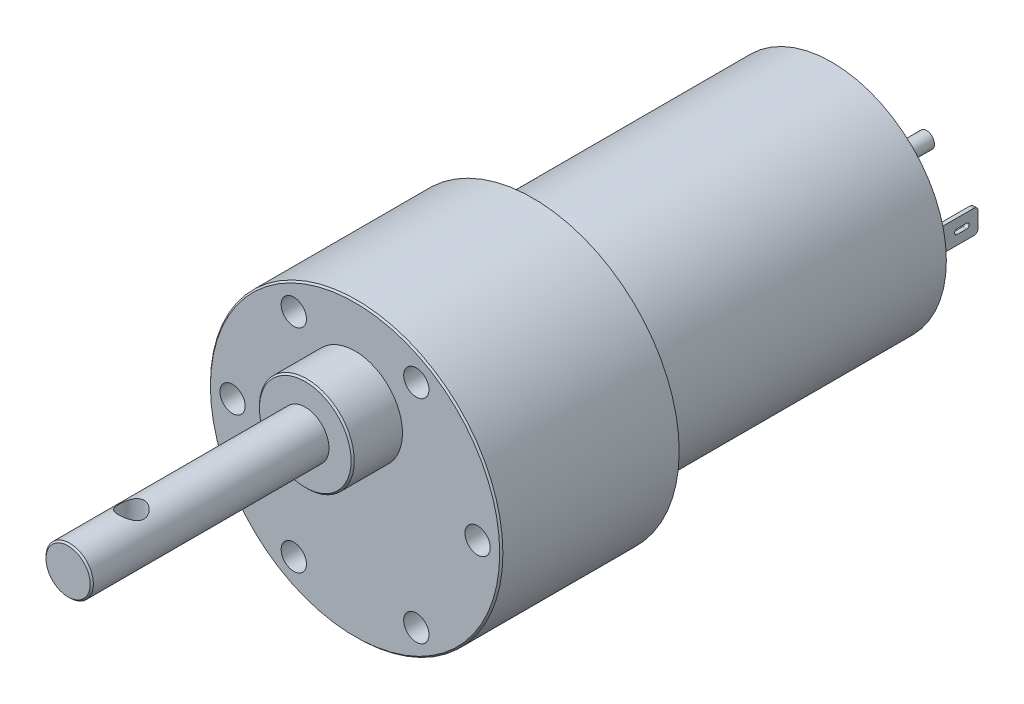
from build123d import *

# Parameters (mm, degrees)
SKETCH1_R               = 18.5
BOSS_EXTRUDE1_DEPTH     = 22.5
SKETCH2_R               = 1.6
CUT_EXTRUDE1_DEPTH      = 3.5
SKETCH3_R               = 3
BOSS_EXTRUDE2_DEPTH     = 36.3
SKETCH3_3_R             = 6
SKETCH3_3_R_2           = 3
BOSS_EXTRUDE3_DEPTH     = 6.3
SKETCH4_R               = 14.5
BOSS_EXTRUDE4_DEPTH     = 37.8
SKETCH5_R               = 5
BOSS_EXTRUDE5_DEPTH     = 3
SKETCH6_R               = 1
BOSS_EXTRUDE6_DEPTH     = 9
SKETCH7_W               = 0.5
SKETCH7_H               = 3
BOSS_EXTRUDE7_DEPTH     = 6.5
CUT_EXTRUDE2_DEPTH      = 0.5
FILLET1_R               = 0.5
CHAMFER1_SIZE           = 0.2
CUT_EXTRUDE3_DEPTH      = 67.7078706
CUT_EXTRUDE3_DEPTH_BACK = 67.7078706
SKETCH9_R               = 1.6


with BuildPart() as part:
    # Sketch1 → Boss-Extrude1 (new body)
    with BuildSketch(Plane.XY):
        Circle(SKETCH1_R)
    extrude(amount=BOSS_EXTRUDE1_DEPTH)

    # Sketch2 → Cut-Extrude1 (cut)
    with BuildSketch(Plane.XY.offset(22.5)):
        with Locations((-7.75, 13.423393759)):
            Circle(SKETCH2_R)
        with Locations((7.75, 13.423393759)):
            Circle(SKETCH2_R)
        with Locations((-15.5, 0)):
            Circle(SKETCH2_R)
        with Locations((-7.75, -13.423393759)):
            Circle(SKETCH2_R)
        with Locations((7.75, -13.423393759)):
            Circle(SKETCH2_R)
        with Locations((15.5, 0)):
            Circle(SKETCH2_R)
    extrude(amount=-CUT_EXTRUDE1_DEPTH, mode=Mode.SUBTRACT)

    # Sketch3 → Boss-Extrude2 (add)
    with BuildSketch(Plane.XY.offset(22.5)):
        with Locations((0, 7)):
            Circle(SKETCH3_R)
    extrude(amount=BOSS_EXTRUDE2_DEPTH)

    # Sketch3<3> → Boss-Extrude3 (add)
    with BuildSketch(Plane.XY.offset(22.5)):
        with Locations((0, 7)):
            Circle(SKETCH3_3_R)
        with Locations((0, 7)):
            Circle(SKETCH3_3_R_2, mode=Mode.SUBTRACT)
    extrude(amount=BOSS_EXTRUDE3_DEPTH)

    # Sketch4 → Boss-Extrude4 (add)
    with BuildSketch(Plane(origin=(0, 0, 0), x_dir=(-1, 0, 0), z_dir=(0, 0, -1))):
        Circle(SKETCH4_R)
    extrude(amount=BOSS_EXTRUDE4_DEPTH)

    # Sketch5 → Boss-Extrude5 (add)
    with BuildSketch(Plane(origin=(0, 0, -37.8), x_dir=(-1, 0, 0), z_dir=(0, 0, -1))):
        Circle(SKETCH5_R)
    extrude(amount=BOSS_EXTRUDE5_DEPTH)

    # Sketch6 → Boss-Extrude6 (add)
    with BuildSketch(Plane(origin=(0, 0, -40.8), x_dir=(-1, 0, 0), z_dir=(0, 0, -1))):
        Circle(SKETCH6_R)
    extrude(amount=BOSS_EXTRUDE6_DEPTH)

    # Sketch7 → Boss-Extrude7 (add)
    with BuildSketch(Plane(origin=(0, 0, -37.8), x_dir=(-1, 0, 0), z_dir=(0, 0, -1))):
        with Locations((-11.75, 0)):
            Rectangle(SKETCH7_W, SKETCH7_H)
        with Locations((11.75, 0)):
            Rectangle(SKETCH7_W, SKETCH7_H)
    extrude(amount=BOSS_EXTRUDE7_DEPTH)

    # Sketch8 → Cut-Extrude2 (cut)
    with BuildSketch(Plane(origin=(12, 0, 0), x_dir=(0, 0, -1), z_dir=(1, 0, 0))):
        with BuildLine():
            Line((42.865122037, -0.320114275), (41.665122037, -0.320114275))
            ThreePointArc((41.665122037, -0.320114275), (41.345007763, 0), (41.665122037, 0.320114275))
            Line((41.665122037, 0.320114275), (42.865122037, 0.320114275))
            ThreePointArc((42.865122037, 0.320114275), (43.185236312, 0), (42.865122037, -0.320114275))
        make_face()
    cut_extrude2 = extrude(amount=-CUT_EXTRUDE2_DEPTH, mode=Mode.SUBTRACT)

    # Mirror2: Cut-Extrude2 across plane
    add(cut_extrude2.mirror(Plane(origin=(0, 0, 0), x_dir=(0, 0, 1), z_dir=(1, 0, 0))), mode=Mode.SUBTRACT)

    # Fillet1
    fillet1_edges = [part.edges().sort_by_distance(p)[0] for p in [
        (-11.75, 1.5, -44.3),
        (-11.75, -1.5, -44.3),
        (11.75, 1.5, -44.3),
        (11.75, -1.5, -44.3),
    ]]
    fillet(fillet1_edges, radius=FILLET1_R)

    # Chamfer1
    chamfer1_edges = [part.edges().sort_by_distance(p)[0] for p in [
        (-18.5, 0, 22.5),
        (-6, 7, 28.8),
        (-3, 7, 58.8),
    ]]
    chamfer(chamfer1_edges, length=CHAMFER1_SIZE)

    # Sketch9 → Cut-Extrude3 (cut, two sides: drawn at the far end of the back side and taken through both)
    with BuildSketch(Plane(origin=(0, 7, 0), x_dir=(1, 0, 0), z_dir=(0, 1, 0)).offset(-CUT_EXTRUDE3_DEPTH_BACK)):
        with Locations((0, -50.8)):
            Circle(SKETCH9_R)
    extrude(amount=CUT_EXTRUDE3_DEPTH + CUT_EXTRUDE3_DEPTH_BACK, mode=Mode.SUBTRACT)


solid = part.part
